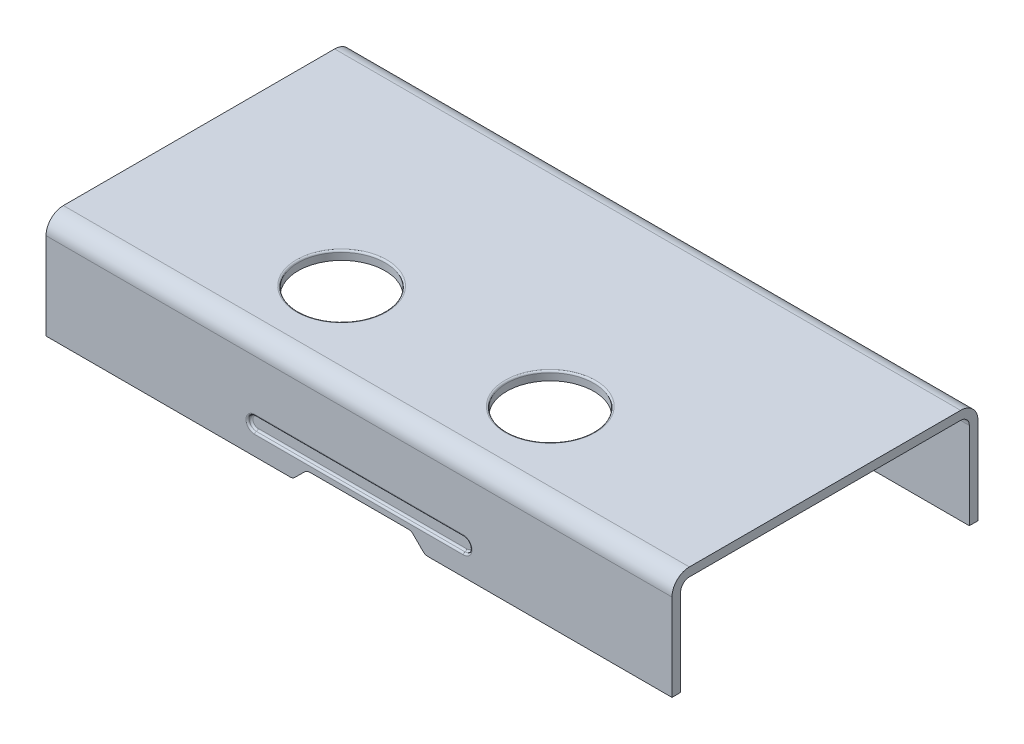
from build123d import *

# Parameters (mm, degrees)
SKETCH1_W           = 18
SKETCH1_H           = 8.8
BOSS_EXTRUDE1_DEPTH = 3
SKETCH2_R           = 1.25
CUT_EXTRUDE1_DEPTH  = 3
FILLET1_R           = 0.5
CUT_EXTRUDE2_DEPTH  = 23
SKETCH4_W           = 4
SKETCH4_H           = 1.424515237
CUT_EXTRUDE3_DEPTH  = 2
CHAMFER1_SIZE       = 0.5
CUT_EXTRUDE4_DEPTH  = 0.1
FILLET2_R           = 0.05
FILLET3_R           = 0.2
FILLET4_R           = 0.05


# Some blends are built 0.0001 mm under size
with BuildPart() as part:
    # Sketch1 → Boss-Extrude1 (new body)
    with BuildSketch(Plane(origin=(0, 0, 0), x_dir=(1, 0, 0), z_dir=(0, 1, 0))):
        Rectangle(SKETCH1_W, SKETCH1_H)
    extrude(amount=BOSS_EXTRUDE1_DEPTH)

    # Sketch2 → Cut-Extrude1 (cut)
    with BuildSketch(Plane(origin=(0, 3, 0), x_dir=(1, 0, 0), z_dir=(0, 1, 0))):
        with Locations(Location((-3, -1.9, 0), (0, 0, 270))):
            Circle(SKETCH2_R)
        with Locations(Location((3, -1.9, 0), (0, 0, 270))):
            Circle(SKETCH2_R)
    extrude(amount=-CUT_EXTRUDE1_DEPTH, mode=Mode.SUBTRACT)

    # Fillet1
    fillet1_edges = [part.edges().sort_by_distance(p)[0] for p in [
        (0, 3, -4.4),
        (0, 3, 4.4),
    ]]
    fillet(fillet1_edges, radius=FILLET1_R)

    # Sketch3 → Cut-Extrude2 (cut)
    with BuildSketch(Plane.ZY.offset(9)):
        with BuildLine():
            Line((-4.15, 0.25), (-4.15, -7.258391717))
            Line((-4.15, -7.258391717), (4.15, -7.258391717))
            Line((4.15, -7.258391717), (4.15, 0.25))
            Line((4.15, 0.25), (4.15, 2.5))
            ThreePointArc((4.15, 2.5), (4.076776695, 2.676776695), (3.9, 2.75))
            Line((3.9, 2.75), (-3.9, 2.75))
            ThreePointArc((-3.9, 2.75), (-4.076776695, 2.676776695), (-4.15, 2.5))
            Line((-4.15, 2.5), (-4.15, 0.25))
        make_face()
    extrude(amount=-CUT_EXTRUDE2_DEPTH, mode=Mode.SUBTRACT)

    # Sketch4 → Cut-Extrude3 (cut)
    with BuildSketch(Plane.XY.offset(4.4)):
        with Locations((0, -0.312257619)):
            Rectangle(SKETCH4_W, SKETCH4_H)
    extrude(amount=-CUT_EXTRUDE3_DEPTH, mode=Mode.SUBTRACT)

    # Chamfer1
    # the kernel refuses this chamfer: 0.5 mm, written as the material it adds along each edge
    with BuildSketch(Plane(origin=(2, 0.4, 4.4), x_dir=(0.027495876610586487, -0.9996219169112968, 0), z_dir=(0, 0, -1))) as chamfer1_piece_1_section:
        Polygon((CHAMFER1_SIZE * 0.999621916911, CHAMFER1_SIZE * 0.0274958766106), (-CHAMFER1_SIZE * 0.0274958766106, CHAMFER1_SIZE * 0.999621916911), (0, 0), align=None)
    chamfer1_piece_1 = extrude(amount=0.25, mode=Mode.PRIVATE)
    chamfer1_piece_1 = split(chamfer1_piece_1, bisect_by=Plane(origin=(1.827140794, 0, 4.275), z_dir=(0, 1, 0)), keep=Keep.TOP, mode=Mode.PRIVATE)
    add(chamfer1_piece_1)
    with BuildSketch(Plane(origin=(-2, 0.4, 4.4), x_dir=(0.9996219169112968, 0.02749587661058639, 0), z_dir=(0, 0, -1))) as chamfer1_piece_2_section:
        Polygon((CHAMFER1_SIZE * 0.999621916911, CHAMFER1_SIZE * 0.0274958766106), (-CHAMFER1_SIZE * 0.0274958766106, CHAMFER1_SIZE * 0.999621916911), (0, 0), align=None)
    chamfer1_piece_2 = extrude(amount=0.25, mode=Mode.PRIVATE)
    chamfer1_piece_2 = split(chamfer1_piece_2, bisect_by=Plane(origin=(-1.827140794, 0, 4.275), z_dir=(0, 1, 0)), keep=Keep.TOP, mode=Mode.PRIVATE)
    add(chamfer1_piece_2)

    # Sketch5 → Cut-Extrude4 (cut)
    with BuildSketch(Plane.XY.offset(4.4)):
        with BuildLine():
            Line((-3, 1), (3, 1))
            ThreePointArc((3, 1), (3.2, 0.8), (3, 0.6))
            Line((3, 0.6), (-3, 0.6))
            ThreePointArc((-3, 0.6), (-3.2, 0.8), (-3, 1))
        make_face()
    extrude(amount=-CUT_EXTRUDE4_DEPTH, mode=Mode.SUBTRACT)

    # Fillet2
    fillet2_edges = [part.edges().sort_by_distance(p)[0] for p in [
        (3.2, 0.8, 4.4),
        (0, 0.6, 4.4),
        (-3.2, 0.8, 4.4),
        (0, 1, 4.3),
        (3.2, 0.8, 4.3),
        (0, 0.6, 4.3),
        (-3.2, 0.8, 4.3),
        (0, 1, 4.4),
    ]]
    fillet(fillet2_edges, radius=FILLET2_R - 0.0001)  # a hair under: the kernel refuses the full size

    # Fillet3
    fillet3_edges = [part.edges().sort_by_distance(p)[0] for p in [
        (-1.5, 0.4, 4.275),
        (1.5, 0.4, 4.275),
        (1.9, 0, 4.275),
        (-1.9, 0, 4.275),
    ]]
    fillet(fillet3_edges, radius=FILLET3_R)

    # Fillet4
    fillet4_edges = [part.edges().sort_by_distance(p)[0] for p in [
        (-3, 3, 0.65),
        (3, 3, 0.65),
    ]]
    fillet(fillet4_edges, radius=FILLET4_R)


solid = part.part
